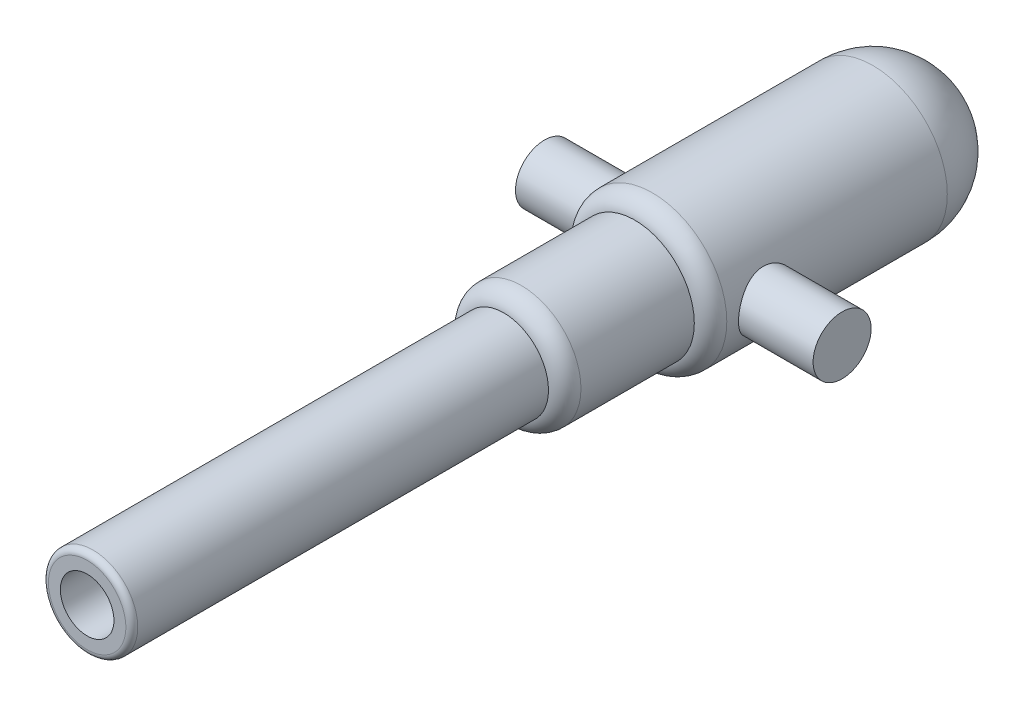
from build123d import *

# Parameters (mm, degrees)
FILLET2_R                = 3
BOSS_EXTRUDE1_DEPTH      = 25
BOSS_EXTRUDE1_DEPTH_BACK = 25
SKETCH3_R                = 4.875
SKETCH2_R                = 4.5
CUT_EXTRUDE2_DEPTH       = 120
FILLET3_R                = 1


with BuildPart() as part:
    # Sketch1 → Revolve1 (revolve)
    with BuildSketch(Plane(origin=(0, 0, 0), x_dir=(0, 0, -1), z_dir=(1, 0, 0)), mode=Mode.PRIVATE) as revolve1_sk:
        with BuildLine():
            Line((0, 12.5), (-40, 12.5))
            Line((-40, 12.5), (-40, 10))
            Line((-40, 10), (-62, 10))
            Line((-62, 10), (-62, 7.5))
            Line((-62, 7.5), (-132, 7.5))
            Line((-132, 7.5), (-132, 0))
            Line((-132, 0), (12.5, 0))
            ThreePointArc((12.5, 0), (8.838834765, 8.838834765), (0, 12.5))
        make_face()
    revolve(revolve1_sk.sketch.rotate(Axis((0, 0, 132), (0, 0, -1)), 90), axis=Axis((0, 0, 132), (0, 0, -1)))

    # Fillet2
    # the kernel refuses this fillet: 3 mm, written as the material it takes off along each edge
    with BuildSketch(Plane(origin=(0, 0, 40), x_dir=(1, 0, 0), z_dir=(0, 1, 0))) as fillet2_piece_1:
        with BuildLine():
            CenterArc((9.5, 2.958039892), FILLET2_R, 279.594068227, 80.405931773)
            Line((10, 0), (10.01, -0.059160798))
            ThreePointArc((10.01, -0.059160798), (11.25, -0.06), (12.5, -0.06))
            Line((12.5, -0.06), (12.56, 0))
            Line((12.56, 0), (12.56, 2.958039892))
            Line((12.56, 2.958039892), (12.5, 2.958039892))
        make_face()
    revolve(axis=Axis((0, 0, 40), (0, 0, -1)), mode=Mode.SUBTRACT)
    with BuildSketch(Plane(origin=(0, 0, 62), x_dir=(1, 0, 0), z_dir=(0, 1, 0))) as fillet2_piece_2:
        with BuildLine():
            CenterArc((7, 2.958039892), FILLET2_R, 279.594068227, 80.405931773)
            Line((7.5, 0), (7.51, -0.059160798))
            ThreePointArc((7.51, -0.059160798), (8.75, -0.06), (10, -0.06))
            Line((10, -0.06), (10.06, 0))
            Line((10.06, 0), (10.06, 2.958039892))
            Line((10.06, 2.958039892), (10, 2.958039892))
        make_face()
    revolve(axis=Axis((0, 0, 62), (0, 0, -1)), mode=Mode.SUBTRACT)

    # Sketch3 → Boss-Extrude1 (add, two sides: drawn at the far end of the back side and taken through both)
    with BuildSketch(Plane(origin=(0, 0, 0), x_dir=(0, 0, -1), z_dir=(1, 0, 0)).offset(-BOSS_EXTRUDE1_DEPTH_BACK)):
        with Locations((-30.171572875, -0.635390854)):
            Circle(SKETCH3_R)
    extrude(amount=BOSS_EXTRUDE1_DEPTH + BOSS_EXTRUDE1_DEPTH_BACK)

    # Sketch2 → Cut-Extrude2 (cut)
    with BuildSketch(Plane.XY.offset(132)):
        Circle(SKETCH2_R)
    extrude(amount=-CUT_EXTRUDE2_DEPTH, mode=Mode.SUBTRACT)

    # Fillet3
    fillet3_edges = [part.edges().sort_by_distance(p)[0] for p in [
        (-7.5, 0, 132),
    ]]
    fillet(fillet3_edges, radius=FILLET3_R)


solid = part.part
